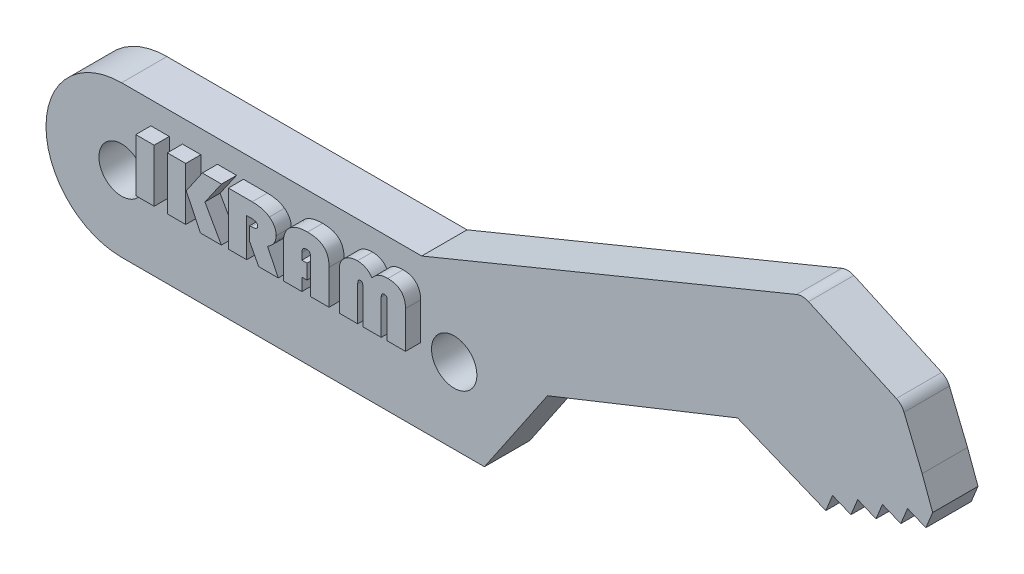
from build123d import *

# Parameters (mm, degrees)
SKETCH1_R           = 1.5
BOSS_EXTRUDE1_DEPTH = 3
SKETCH6_W           = 1.215277778
SKETCH6_H           = 3.5
BOSS_EXTRUDE4_DEPTH = 1


with BuildPart() as part:
    # Sketch1 → Boss-Extrude1 (new body)
    with BuildSketch(Plane.XY):
        with BuildLine():
            Line((0, 5), (19.85, 5))
            Line((19.85, 5), (44.643069029, 15.193663072))
            ThreePointArc((44.643069029, 15.193663072), (45.042006379, 15.268610471), (45.43786686, 15.178818479))
            Line((45.43786686, 15.178818479), (51.245085043, 12.533540635))
            ThreePointArc((51.245085043, 12.533540635), (51.550738574, 12.317286013), (51.755428853, 12.003770413))
            Line((51.755428853, 12.003770413), (52.954960556, 9.086264498))
            Line((52.954960556, 9.086264498), (53.647413738, 7.201821951))
            Line((53.647413738, 7.201821951), (53.200417763, 6.109762155))
            Line((53.200417763, 6.109762155), (51.987413738, 6.606262365))
            Line((51.987413738, 6.606262365), (51.540417763, 5.514202569))
            Line((51.540417763, 5.514202569), (50.327413738, 6.010702778))
            Line((50.327413738, 6.010702778), (49.901790908, 4.970859901))
            Line((49.901790908, 4.970859901), (48.688786884, 5.467360111))
            Line((48.688786884, 5.467360111), (48.241790908, 4.375300315))
            Line((48.241790908, 4.375300315), (47.028786884, 4.871800524))
            Line((47.028786884, 4.871800524), (46.581790908, 3.779740729))
            Line((46.581790908, 3.779740729), (40.742047423, 6.170032768))
            Line((40.742047423, 6.170032768), (28.174379319, 1.158584034))
            Line((28.174379319, 1.158584034), (24, -5))
            Line((24, -5), (22, -5))
            Line((22, -5), (0, -5))
            ThreePointArc((0, -5), (-5, 0), (0, 5))
        make_face()
        Circle(SKETCH1_R, mode=Mode.SUBTRACT)
        with Locations((22, 0)):
            Circle(SKETCH1_R, mode=Mode.SUBTRACT)
    extrude(amount=BOSS_EXTRUDE1_DEPTH)

    # Sketch6 → Boss-Extrude4 (add)
    with BuildSketch(Plane.XY.offset(3)):
        with Locations((2.545138889, 1.75)):
            Rectangle(SKETCH6_W, SKETCH6_H)
        Polygon((7.606770833, 3.5), (6.513020833, 1.927734375), (7.600694444, 0), (6.215277778, 0), (5.276475694, 1.948242188), (6.33984375, 3.5), align=None)
        with Locations((4.635416667, 1.75)):
            Rectangle(SKETCH6_W, SKETCH6_H)
        with BuildLine():
            Line((9.277777778, 2.527777778), (9.277777778, 0))
            Line((9.277777778, 0), (8.0625, 0))
            Line((8.0625, 0), (8.0625, 3.5))
            Line((8.0625, 3.5), (9.639322917, 3.5))
            add(Edge.make_bspline(
                [(9.639322917, 3.5), (9.698600432, 3.499251926), (9.813798018, 3.497798147), (9.981459402, 3.482920319), (10.139044882, 3.459675426), (10.286774322, 3.427522905), (10.423965817, 3.384933555), (10.5509352, 3.333189267), (10.667984295, 3.272268785), (10.738620591, 3.222777584), (10.773328993, 3.198459201)],
                knots=[0, 0, 0, 0, 1.191859518, 2.316212806, 3.381957352, 4.393729136, 5.353573376, 6.266970232, 7.148444956, 8, 8, 8, 8], degree=3))
            add(Edge.make_bspline(
                [(10.773328993, 3.198459201), (10.809189494, 3.17036795), (10.879186263, 3.115536122), (10.970803623, 3.022022798), (11.048096373, 2.922751028), (11.111640404, 2.818023269), (11.161881413, 2.707803411), (11.196379567, 2.591457605), (11.218728923, 2.469644268), (11.221044181, 2.386349012), (11.222222222, 2.343967014)],
                knots=[0, 0, 0, 0, 1.088531677, 2.12472491, 3.12154828, 4.091470599, 5.048128236, 6.009736294, 6.987321042, 8, 8, 8, 8], degree=3))
            add(Edge.make_bspline(
                [(11.222222222, 2.343967014), (11.220492973, 2.300525675), (11.21708194, 2.214835389), (11.18914045, 2.089296486), (11.145118211, 1.968843125), (11.081723367, 1.854134583), (11.000864963, 1.744553341), (10.902249765, 1.640513085), (10.785744767, 1.541927273), (10.698985681, 1.48334053), (10.654079861, 1.453016493)],
                knots=[0, 0, 0, 0, 0.942320941, 1.858776735, 2.778836005, 3.718571919, 4.69381295, 5.728237832, 6.824153776, 8, 8, 8, 8], degree=3))
            Line((10.654079861, 1.453016493), (11.365017361, 0))
            Line((11.365017361, 0), (10.070746528, 0))
            Line((10.070746528, 0), (9.472222222, 1.135525174))
            Line((9.472222222, 1.135525174), (9.472222222, 2.041666667))
            Line((9.472222222, 2.041666667), (9.569444444, 2.041666667))
            add(Edge.make_bspline(
                [(9.569444444, 2.041666667), (9.603661399, 2.042238746), (9.667788545, 2.043310899), (9.757354907, 2.055091832), (9.833373193, 2.075216943), (9.896612436, 2.1028079), (9.946150724, 2.139818119), (9.982049534, 2.185466122), (10.00354824, 2.240189797), (10.00578151, 2.279462608), (10.006944444, 2.299913194)],
                knots=[0, 0, 0, 0, 1.437041927, 2.693208592, 3.784780098, 4.732051876, 5.574563009, 6.355457029, 7.14363479, 8, 8, 8, 8], degree=3))
            add(Edge.make_bspline(
                [(10.006944444, 2.299913194), (10.005661831, 2.317946429), (10.003138062, 2.35343002), (9.977187424, 2.401995393), (9.936647421, 2.442812056), (9.879751589, 2.474078531), (9.808731261, 2.499020472), (9.722214695, 2.515326754), (9.620596258, 2.525868561), (9.54770344, 2.52711207), (9.508680556, 2.527777778)],
                knots=[0, 0, 0, 0, 0.710483105, 1.398001714, 2.129833801, 2.967360494, 3.949421895, 5.108097643, 6.451831393, 8, 8, 8, 8], degree=3))
            Line((9.508680556, 2.527777778), (9.277777778, 2.527777778))
        make_face()
        with BuildLine():
            Line((13.263888889, 1.798611111), (13.263888889, 0.826388889))
            Line((13.263888889, 0.826388889), (12.923611111, 0.826388889))
            Line((12.923611111, 0.826388889), (12.923611111, 0))
            Line((12.923611111, 0), (11.708333333, 0))
            Line((11.708333333, 0), (11.708333333, 2.255099826))
            add(Edge.make_bspline(
                [(11.708333333, 2.255099826), (11.709711129, 2.306805616), (11.712395349, 2.407538786), (11.731389148, 2.554435273), (11.763797342, 2.692227663), (11.809751613, 2.821096534), (11.868392423, 2.941420177), (11.940821023, 3.052444378), (12.026129878, 3.154781707), (12.124380321, 3.247107947), (12.233884713, 3.330277374), (12.354954114, 3.401707703), (12.48612338, 3.46280817), (12.62830756, 3.511798564), (12.780689336, 3.550729423), (12.943626513, 3.577283046), (13.11691875, 3.594659855), (13.235993867, 3.596351266), (13.297309028, 3.597222222)],
                knots=[0, 0, 0, 0, 1.051608752, 2.048743188, 3.006824981, 3.925536517, 4.826083395, 5.723133564, 6.615277206, 7.529662715, 8.459750185, 9.406554301, 10.38346869, 11.398162815, 12.461109995, 13.578681589, 14.753194348, 16, 16, 16, 16], degree=3))
            add(Edge.make_bspline(
                [(13.297309028, 3.597222222), (13.356074275, 3.596122483), (13.469738271, 3.593995363), (13.634286635, 3.579951432), (13.786904672, 3.554970362), (13.927950924, 3.520154214), (14.057710782, 3.47614178), (14.174653342, 3.419903066), (14.280859311, 3.355497144), (14.374760349, 3.279607779), (14.458113726, 3.193876106), (14.528806518, 3.096266743), (14.589267308, 2.988566458), (14.637817217, 2.869553358), (14.675579738, 2.739934739), (14.702489947, 2.599568264), (14.7196662, 2.448450857), (14.721351284, 2.344016218), (14.722222222, 2.290039062)],
                knots=[0, 0, 0, 0, 1.267014597, 2.450665122, 3.55718399, 4.597809516, 5.580102781, 6.505491729, 7.390236099, 8.252136688, 9.101464788, 9.960733824, 10.84299923, 11.758400305, 12.725699579, 13.749160013, 14.836650946, 16, 16, 16, 16], degree=3))
            Line((14.722222222, 2.290039062), (14.722222222, 0))
            Line((14.722222222, 0), (13.506944444, 0))
            Line((13.506944444, 0), (13.506944444, 2.222439236))
            add(Edge.make_bspline(
                [(13.506944444, 2.222439236), (13.506314815, 2.253108109), (13.505149172, 2.309885859), (13.49455962, 2.387412768), (13.476020554, 2.450135852), (13.449148569, 2.499699938), (13.409975834, 2.536175804), (13.359449204, 2.560215695), (13.297589511, 2.57460084), (13.25258585, 2.575760342), (13.228190104, 2.576388889)],
                knots=[0, 0, 0, 0, 1.397749798, 2.58767538, 3.555054617, 4.366764164, 5.126158565, 5.952022647, 6.889825085, 8, 8, 8, 8], degree=3))
            add(Edge.make_bspline(
                [(13.228190104, 2.576388889), (13.204284988, 2.575566549), (13.159093452, 2.574011952), (13.095680559, 2.557114646), (13.042214647, 2.528379523), (12.996832343, 2.489505396), (12.963341756, 2.437632763), (12.940016211, 2.37520633), (12.925598276, 2.302334652), (12.924299312, 2.25010887), (12.923611111, 2.222439236)],
                knots=[0, 0, 0, 0, 1.071937331, 2.026448861, 2.916819678, 3.779076888, 4.681136081, 5.656819869, 6.758564531, 8, 8, 8, 8], degree=3))
            Line((12.923611111, 2.222439236), (12.923611111, 1.798611111))
            Line((12.923611111, 1.798611111), (13.263888889, 1.798611111))
        make_face()
        with BuildLine():
            Line((15.402777778, 0), (15.402777778, 2.54296875))
            add(Edge.make_bspline(
                [(15.402777778, 2.54296875), (15.403807561, 2.580999007), (15.405820756, 2.655347054), (15.421373921, 2.764303493), (15.446856163, 2.867825039), (15.483850735, 2.966077793), (15.530900615, 3.058852435), (15.588665837, 3.146340027), (15.656282375, 3.228434682), (15.7340094, 3.304155802), (15.819434508, 3.373242248), (15.912148772, 3.433258596), (16.011340171, 3.483632109), (16.116137732, 3.525784956), (16.227838885, 3.557126503), (16.345275999, 3.581131325), (16.469120227, 3.594631926), (16.553716084, 3.596348318), (16.596788194, 3.597222222)],
                knots=[0, 0, 0, 0, 1.020846018, 1.995724295, 2.948739816, 3.878087045, 4.808428335, 5.736108126, 6.687497691, 7.658576, 8.644906916, 9.63299339, 10.618081824, 11.628004034, 12.660799917, 13.728729891, 14.843579335, 16, 16, 16, 16], degree=3))
            add(Edge.make_bspline(
                [(16.596788194, 3.597222222), (16.647777329, 3.595915762), (16.747292103, 3.593365963), (16.891808576, 3.569050947), (17.027320134, 3.530507202), (17.153938823, 3.476313853), (17.27126174, 3.405792621), (17.378757097, 3.318953552), (17.47797575, 3.217488829), (17.534250999, 3.139982013), (17.562934028, 3.100477431)],
                knots=[0, 0, 0, 0, 1.077840145, 2.103605401, 3.090142477, 4.052184509, 5.008349752, 5.976099518, 6.968434687, 8, 8, 8, 8], degree=3))
            add(Edge.make_bspline(
                [(17.562934028, 3.100477431), (17.598126736, 3.142428479), (17.666136656, 3.223498893), (17.777343288, 3.3302152), (17.893506332, 3.416859334), (18.015280685, 3.485704798), (18.146617741, 3.536468424), (18.290087484, 3.571496675), (18.447091657, 3.594122786), (18.556593225, 3.596163658), (18.613389757, 3.597222222)],
                knots=[0, 0, 0, 0, 1.085228357, 2.097204147, 3.048012857, 3.951526861, 4.862319321, 5.830267963, 6.874598258, 8, 8, 8, 8], degree=3))
            add(Edge.make_bspline(
                [(18.613389757, 3.597222222), (18.658994698, 3.596379936), (18.747635891, 3.594742806), (18.876766268, 3.581127601), (18.997350463, 3.557522542), (19.110293828, 3.525948353), (19.214635871, 3.484045229), (19.311008757, 3.433045943), (19.399046288, 3.372754851), (19.478269696, 3.30312458), (19.549470973, 3.2256354), (19.610526847, 3.138871), (19.662116508, 3.044203157), (19.705270196, 2.941563293), (19.73719905, 2.830520176), (19.76083322, 2.71164114), (19.775517762, 2.584858612), (19.777011422, 2.497436365), (19.777777778, 2.452582465)],
                knots=[0, 0, 0, 0, 1.175412491, 2.284620103, 3.34186384, 4.339641751, 5.30312713, 6.234489877, 7.145063394, 8.046965144, 8.947827292, 9.851427629, 10.774406275, 11.722247376, 12.715575674, 13.747208193, 14.844155791, 16, 16, 16, 16], degree=3))
            Line((19.777777778, 2.452582465), (19.777777778, 0))
            Line((19.777777778, 0), (18.5625, 0))
            Line((18.5625, 0), (18.5625, 2.294596354))
            add(Edge.make_bspline(
                [(18.5625, 2.294596354), (18.562151095, 2.320687696), (18.561516138, 2.368170126), (18.555123936, 2.43236162), (18.544530635, 2.482375465), (18.528889211, 2.520731331), (18.503684674, 2.547163615), (18.470526176, 2.565462238), (18.427966176, 2.574089092), (18.396942874, 2.575583031), (18.380208333, 2.576388889)],
                knots=[0, 0, 0, 0, 1.590247048, 2.894017355, 3.923509988, 4.703894428, 5.380827561, 6.106330831, 6.978520009, 8, 8, 8, 8], degree=3))
            add(Edge.make_bspline(
                [(18.380208333, 2.576388889), (18.363884143, 2.575923155), (18.332921116, 2.57503977), (18.290053998, 2.561282193), (18.253013678, 2.540859905), (18.223371304, 2.510535803), (18.200407395, 2.472586666), (18.184682134, 2.426237217), (18.174888016, 2.372231038), (18.174052942, 2.333380845), (18.173611111, 2.312825521)],
                knots=[0, 0, 0, 0, 1.020862276, 1.936328024, 2.798297217, 3.652900275, 4.566568687, 5.562477654, 6.710326521, 8, 8, 8, 8], degree=3))
            Line((18.173611111, 2.312825521), (18.173611111, 0))
            Line((18.173611111, 0), (16.958333333, 0))
            Line((16.958333333, 0), (16.958333333, 2.294596354))
            add(Edge.make_bspline(
                [(16.958333333, 2.294596354), (16.957904217, 2.320179254), (16.957116756, 2.367125875), (16.951538017, 2.430451058), (16.942296645, 2.480405472), (16.928427914, 2.518555033), (16.906263925, 2.546157337), (16.876356508, 2.563919751), (16.839284246, 2.574579014), (16.81207652, 2.575752148), (16.797309028, 2.576388889)],
                knots=[0, 0, 0, 0, 1.633416876, 2.997447635, 4.053155325, 4.872658667, 5.561915542, 6.266174324, 7.058934285, 8, 8, 8, 8], degree=3))
            add(Edge.make_bspline(
                [(16.797309028, 2.576388889), (16.783273738, 2.575541139), (16.756320575, 2.573913133), (16.718423639, 2.560577348), (16.686109304, 2.537885129), (16.66093162, 2.505274041), (16.640837439, 2.464841246), (16.627997448, 2.415497804), (16.61961065, 2.357926122), (16.61859733, 2.316659614), (16.618055556, 2.294596354)],
                knots=[0, 0, 0, 0, 0.891257814, 1.711558252, 2.520550252, 3.368385699, 4.304933688, 5.375917287, 6.597026467, 8, 8, 8, 8], degree=3))
            Line((16.618055556, 2.294596354), (16.618055556, 0))
            Line((16.618055556, 0), (15.402777778, 0))
        make_face()
    extrude(amount=BOSS_EXTRUDE4_DEPTH)


solid = part.part
